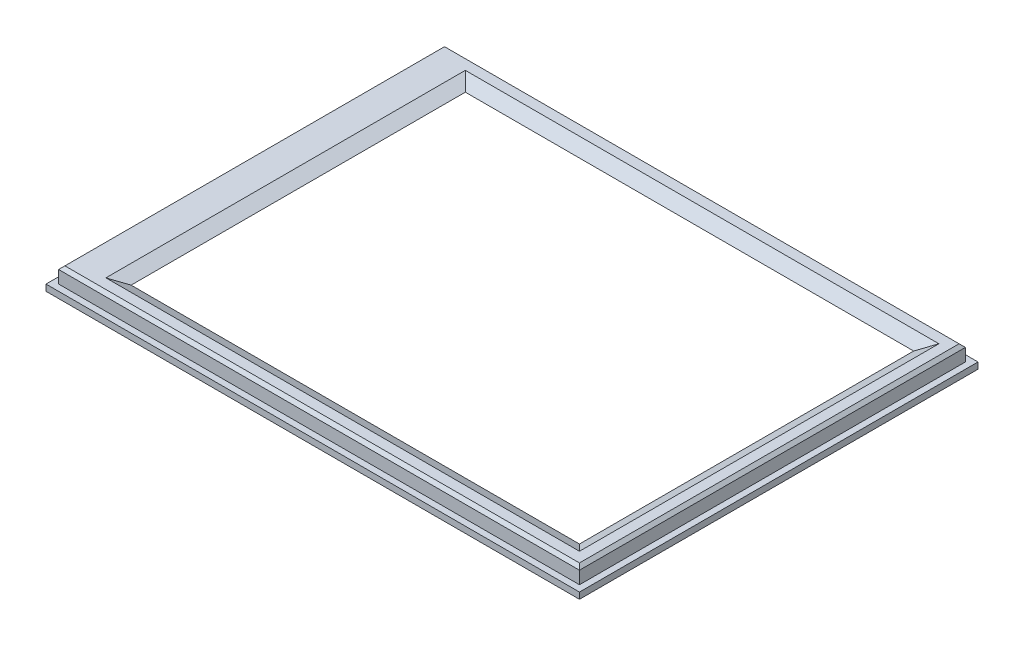
from build123d import *

# Parameters (mm, degrees)
SKETCH1_W           = 84.6
SKETCH1_H           = 63.2
SKETCH1_W_2         = 80.6
SKETCH1_H_2         = 59.2
BOSS_EXTRUDE1_DEPTH = 1
SKETCH2_W           = 82.6
SKETCH2_H           = 61.2
SKETCH2_W_2         = 80.6
SKETCH2_H_2         = 59.2
BOSS_EXTRUDE2_DEPTH = 2.5
SKETCH3_W           = 82.6
SKETCH3_H           = 61.2
SKETCH3_W_2         = 71.1
SKETCH3_H_2         = 53
BOSS_EXTRUDE3_DEPTH = 1
CHAMFER1_SIZE       = 2
CHAMFER1_SIZE_2     = 1
CHAMFER2_SIZE       = 0.5


with BuildPart() as part:
    # Sketch1 → Boss-Extrude1 (new body)
    with BuildSketch(Plane(origin=(0, 0, 0), x_dir=(1, 0, 0), z_dir=(0, 1, 0))):
        with Locations((42.3, 31.6)):
            Rectangle(SKETCH1_W, SKETCH1_H)
        with Locations((42.3, 31.6)):
            Rectangle(SKETCH1_W_2, SKETCH1_H_2, mode=Mode.SUBTRACT)
    extrude(amount=BOSS_EXTRUDE1_DEPTH)

    # Sketch2 → Boss-Extrude2 (add)
    with BuildSketch(Plane(origin=(0, 1, 0), x_dir=(1, 0, 0), z_dir=(0, 1, 0))):
        with Locations((42.3, 31.6)):
            Rectangle(SKETCH2_W, SKETCH2_H)
        with Locations((42.3, 31.6)):
            Rectangle(SKETCH2_W_2, SKETCH2_H_2, mode=Mode.SUBTRACT)
    extrude(amount=BOSS_EXTRUDE2_DEPTH)

    # Sketch3 → Boss-Extrude3 (add)
    with BuildSketch(Plane(origin=(0, 3.5, 0), x_dir=(1, 0, 0), z_dir=(0, 1, 0))):
        with Locations((42.3, 31.6)):
            Rectangle(SKETCH3_W, SKETCH3_H)
        with Locations((43.95, 31.6)):
            Rectangle(SKETCH3_W_2, SKETCH3_H_2, mode=Mode.SUBTRACT)
    extrude(amount=-BOSS_EXTRUDE3_DEPTH)

    # Chamfer1
    # the kernel refuses this chamfer: 2, 1 mm, written as the material it takes off along each edge
    with BuildSketch(Plane(origin=(79.5, 3.5, -58.1), x_dir=(0.9998508956747119, 0.01726807512366803, 0), z_dir=(0, 0, 1)), Plane(origin=(8.4, 3.5, -5.1), x_dir=(-0.9998508956747119, 0.01726807512366807, 0), z_dir=(0, 0, -1))) as chamfer1_piece_1:
        Polygon((CHAMFER1_SIZE * 0.999850895675, -CHAMFER1_SIZE * 0.0172680751237), (-CHAMFER1_SIZE_2 * 0.0172680751237, -CHAMFER1_SIZE_2 * 0.999850895675), (0, 0), align=None)
    extrude(amount=53, mode=Mode.SUBTRACT)
    with BuildSketch(Plane(origin=(79.5, 3.5, -5.1), x_dir=(0, 0.017268075123668084, 0.9998508956747119), z_dir=(-1, 0, 0)), Plane(origin=(8.4, 3.5, -58.1), x_dir=(0, 0.017268075123668087, -0.9998508956747116), z_dir=(1, 0, 0))) as chamfer1_piece_2:
        Polygon((CHAMFER1_SIZE * 0.999850895675, -CHAMFER1_SIZE * 0.0172680751237), (-CHAMFER1_SIZE_2 * 0.0172680751237, -CHAMFER1_SIZE_2 * 0.999850895675), (0, 0), align=None)
    extrude(amount=71.1, mode=Mode.SUBTRACT)
    with BuildSketch(Plane(origin=(8.4, 3.5, -58.1), x_dir=(0, 0.017268075123668087, -0.9998508956747116), z_dir=(1, 0, 0))) as chamfer1_piece_3a_section:
        Polygon((CHAMFER1_SIZE * 0.999850895675, -CHAMFER1_SIZE * 0.0172680751237), (-CHAMFER1_SIZE_2 * 0.0172680751237, -CHAMFER1_SIZE_2 * 0.999850895675), (0, 0), align=None)
    chamfer1_piece_3a = extrude(amount=76.279657748, mode=Mode.PRIVATE)
    chamfer1_piece_3a = split(chamfer1_piece_3a, bisect_by=Plane(origin=(79.5, 3.182784452, -58.774507016), z_dir=(1, 0, 0)), keep=Keep.TOP, mode=Mode.PRIVATE)
    with BuildSketch(Plane(origin=(79.5, 3.5, -63.279657748), x_dir=(0.9998508956747119, 0.01726807512366803, 0), z_dir=(0, 0, 1))) as chamfer1_piece_3b_section:
        Polygon((CHAMFER1_SIZE * 0.999850895675, -CHAMFER1_SIZE * 0.0172680751237), (-CHAMFER1_SIZE_2 * 0.0172680751237, -CHAMFER1_SIZE_2 * 0.999850895675), (0, 0), align=None)
    chamfer1_piece_3b = extrude(amount=58.179657748, mode=Mode.PRIVATE)
    chamfer1_piece_3b = split(chamfer1_piece_3b, bisect_by=Plane(origin=(80.174507016, 3.182784452, -58.1), z_dir=(0, 0, -1)), keep=Keep.TOP, mode=Mode.PRIVATE)
    chamfer1_piece_3 = chamfer1_piece_3a & chamfer1_piece_3b
    add(chamfer1_piece_3, mode=Mode.SUBTRACT)
    with BuildSketch(Plane(origin=(84.679657748, 3.5, -5.1), x_dir=(0, 0.017268075123668084, 0.9998508956747119), z_dir=(-1, 0, 0))) as chamfer1_piece_4a_section:
        Polygon((CHAMFER1_SIZE * 0.999850895675, -CHAMFER1_SIZE * 0.0172680751237), (-CHAMFER1_SIZE_2 * 0.0172680751237, -CHAMFER1_SIZE_2 * 0.999850895675), (0, 0), align=None)
    chamfer1_piece_4a = extrude(amount=76.279657748, mode=Mode.PRIVATE)
    chamfer1_piece_4a = split(chamfer1_piece_4a, bisect_by=Plane(origin=(79.5, 3.182784452, -4.425492984), z_dir=(1, 0, 0)), keep=Keep.TOP, mode=Mode.PRIVATE)
    with BuildSketch(Plane(origin=(79.5, 3.5, -58.1), x_dir=(0.9998508956747119, 0.01726807512366803, 0), z_dir=(0, 0, 1))) as chamfer1_piece_4b_section:
        Polygon((CHAMFER1_SIZE * 0.999850895675, -CHAMFER1_SIZE * 0.0172680751237), (-CHAMFER1_SIZE_2 * 0.0172680751237, -CHAMFER1_SIZE_2 * 0.999850895675), (0, 0), align=None)
    chamfer1_piece_4b = extrude(amount=58.179657748, mode=Mode.PRIVATE)
    chamfer1_piece_4b = split(chamfer1_piece_4b, bisect_by=Plane(origin=(80.174507016, 3.182784452, -5.1), z_dir=(0, 0, 1)), keep=Keep.TOP, mode=Mode.PRIVATE)
    chamfer1_piece_4 = chamfer1_piece_4a & chamfer1_piece_4b
    add(chamfer1_piece_4, mode=Mode.SUBTRACT)
    with BuildSketch(Plane(origin=(8.4, 3.5, 0.079657748), x_dir=(-0.9998508956747119, 0.017268075123668084, 0), z_dir=(0, 0, -1))) as chamfer1_piece_5a_section:
        Polygon((CHAMFER1_SIZE * 0.999850895675, -CHAMFER1_SIZE * 0.0172680751237), (-CHAMFER1_SIZE_2 * 0.0172680751237, -CHAMFER1_SIZE_2 * 0.999850895675), (0, 0), align=None)
    chamfer1_piece_5a = extrude(amount=58.179657748, mode=Mode.PRIVATE)
    chamfer1_piece_5a = split(chamfer1_piece_5a, bisect_by=Plane(origin=(7.725492984, 3.182784452, -5.1), z_dir=(0, 0, 1)), keep=Keep.TOP, mode=Mode.PRIVATE)
    with BuildSketch(Plane(origin=(79.5, 3.5, -5.1), x_dir=(0, 0.017268075123668084, 0.9998508956747119), z_dir=(-1, 0, 0))) as chamfer1_piece_5b_section:
        Polygon((CHAMFER1_SIZE * 0.999850895675, -CHAMFER1_SIZE * 0.0172680751237), (-CHAMFER1_SIZE_2 * 0.0172680751237, -CHAMFER1_SIZE_2 * 0.999850895675), (0, 0), align=None)
    chamfer1_piece_5b = extrude(amount=76.279657748, mode=Mode.PRIVATE)
    chamfer1_piece_5b = split(chamfer1_piece_5b, bisect_by=Plane(origin=(8.4, 3.182784452, -4.425492984), z_dir=(-1, 0, 0)), keep=Keep.TOP, mode=Mode.PRIVATE)
    chamfer1_piece_5 = chamfer1_piece_5a & chamfer1_piece_5b
    add(chamfer1_piece_5, mode=Mode.SUBTRACT)
    with BuildSketch(Plane(origin=(3.220342252, 3.5, -58.1), x_dir=(0, 0.017268075123668087, -0.9998508956747116), z_dir=(1, 0, 0))) as chamfer1_piece_6a_section:
        Polygon((CHAMFER1_SIZE * 0.999850895675, -CHAMFER1_SIZE * 0.0172680751237), (-CHAMFER1_SIZE_2 * 0.0172680751237, -CHAMFER1_SIZE_2 * 0.999850895675), (0, 0), align=None)
    chamfer1_piece_6a = extrude(amount=76.279657748, mode=Mode.PRIVATE)
    chamfer1_piece_6a = split(chamfer1_piece_6a, bisect_by=Plane(origin=(8.4, 3.182784452, -58.774507016), z_dir=(-1, 0, 0)), keep=Keep.TOP, mode=Mode.PRIVATE)
    with BuildSketch(Plane(origin=(8.4, 3.5, -5.1), x_dir=(-0.9998508956747119, 0.01726807512366807, 0), z_dir=(0, 0, -1))) as chamfer1_piece_6b_section:
        Polygon((CHAMFER1_SIZE * 0.999850895675, -CHAMFER1_SIZE * 0.0172680751237), (-CHAMFER1_SIZE_2 * 0.0172680751237, -CHAMFER1_SIZE_2 * 0.999850895675), (0, 0), align=None)
    chamfer1_piece_6b = extrude(amount=58.179657748, mode=Mode.PRIVATE)
    chamfer1_piece_6b = split(chamfer1_piece_6b, bisect_by=Plane(origin=(7.725492984, 3.182784452, -58.1), z_dir=(0, 0, -1)), keep=Keep.TOP, mode=Mode.PRIVATE)
    chamfer1_piece_6 = chamfer1_piece_6a & chamfer1_piece_6b
    add(chamfer1_piece_6, mode=Mode.SUBTRACT)

    # Chamfer2
    chamfer2_edges = [part.edges().sort_by_distance(p)[0] for p in [
        (1, 3.5, -31.6),
        (42.3, 3.5, -1),
        (83.6, 3.5, -31.6),
        (42.3, 3.5, -62.2),
    ]]
    chamfer(chamfer2_edges, length=CHAMFER2_SIZE)


solid = part.part
